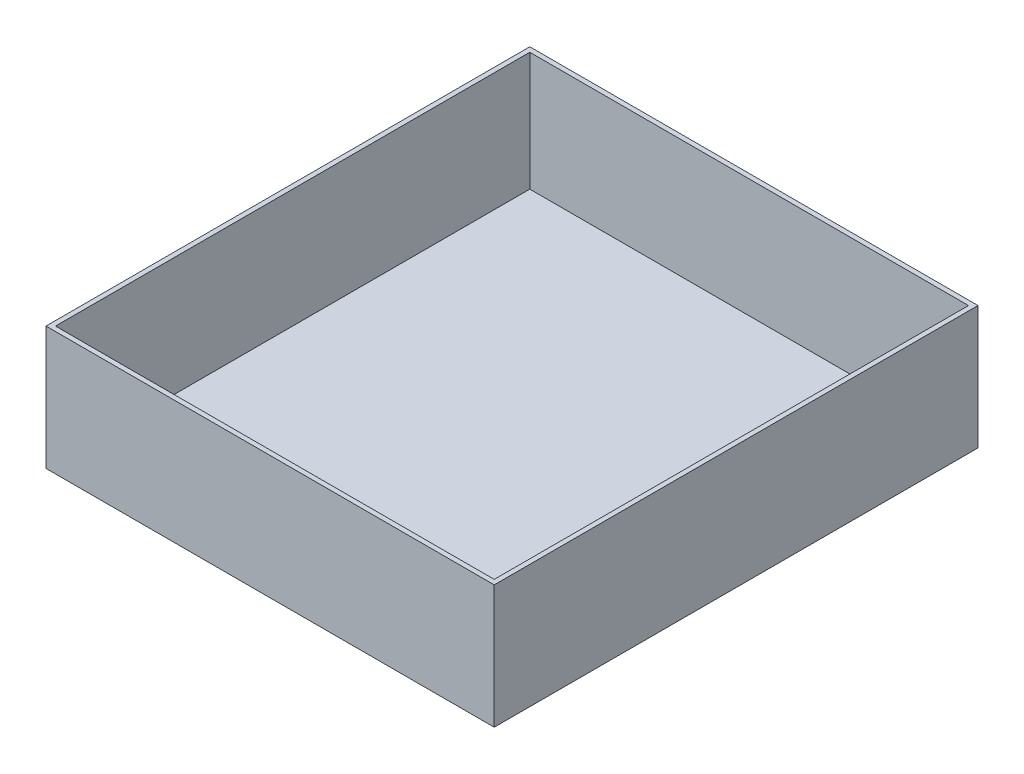
from build123d import *

# Parameters (mm, degrees)
SKETCH2_W   = 189
SKETCH2_H   = 204
SKETCH2_W_2 = 185
SKETCH2_H_2 = 200
WALLS_DEPTH = 50
SKETCH3_W   = 189
SKETCH3_H   = 204
BASE_DEPTH  = 2


with BuildPart() as part:
    # Sketch2 → Walls (new body)
    with BuildSketch(Plane(origin=(0, 0, 0), x_dir=(1, 0, 0), z_dir=(0, 1, 0))):
        Rectangle(SKETCH2_W, SKETCH2_H)
        Rectangle(SKETCH2_W_2, SKETCH2_H_2, mode=Mode.SUBTRACT)
    extrude(amount=WALLS_DEPTH)

    # Sketch3 → Base (add)
    with BuildSketch(Plane.XZ):
        Rectangle(SKETCH3_W, SKETCH3_H)
    extrude(amount=BASE_DEPTH)


solid = part.part
